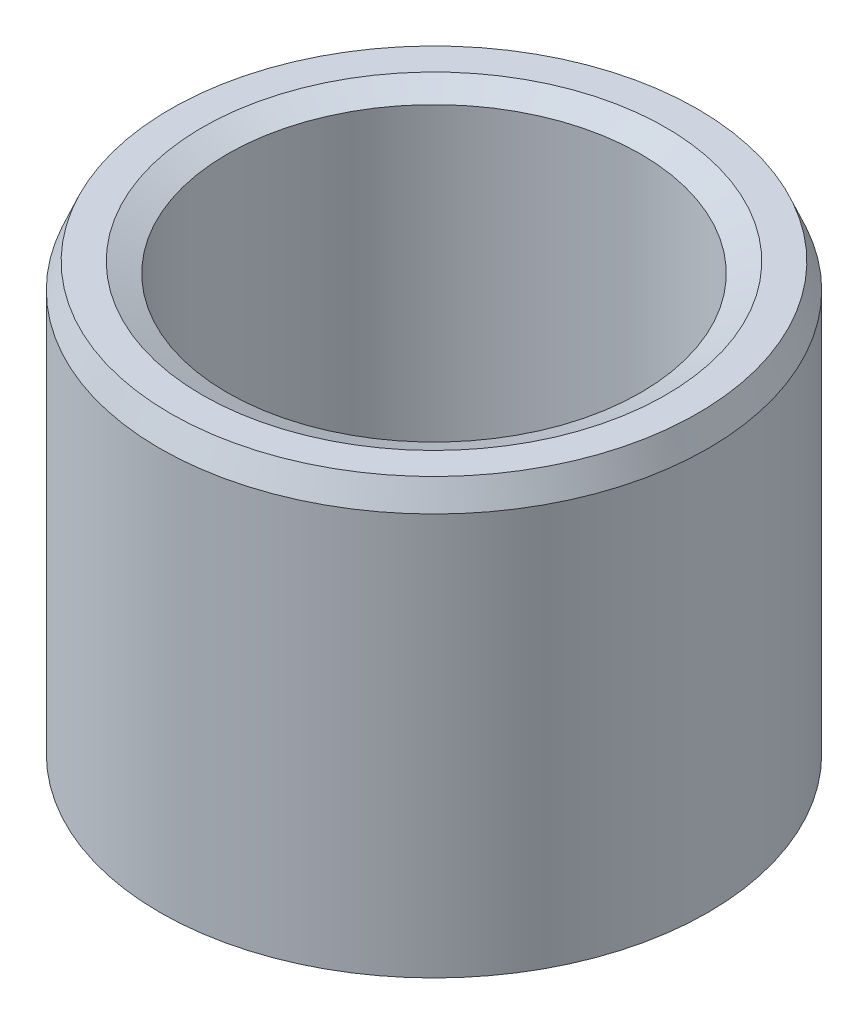
from build123d import *
from OCP.BRepFilletAPI import BRepFilletAPI_MakeChamfer

# Parameters (mm, degrees)
SKETCH1_R           = 15
BOSS_EXTRUDE1_DEPTH = 23.930354002
SKETCH2_R           = 11.30816081
CUT_EXTRUDE1_DEPTH  = 32.979084456
CHAMFER1_SIZE       = 1.372455121
CHAMFER1_SIZE2      = 0.574381194


with BuildPart() as part:
    # Sketch1 → Boss-Extrude1 (new body)
    with BuildSketch(Plane(origin=(0, 0, 0), x_dir=(1, 0, 0), z_dir=(0, 1, 0))):
        Circle(SKETCH1_R)
    extrude(amount=BOSS_EXTRUDE1_DEPTH)

    # Sketch2 → Cut-Extrude1 (cut, through all)
    with BuildSketch(Plane(origin=(0, 0, 0), x_dir=(1, 0, 0), z_dir=(0, 1, 0))):
        Circle(SKETCH2_R)
    extrude(amount=CUT_EXTRUDE1_DEPTH, mode=Mode.SUBTRACT)

    # Chamfer1: one chamfer whose edges measure the first distance from different faces: ONE call of the kernel's chamfer builder (chamfer() names one face for all edges)
    chamfer1_edges_1 = [part.edges().sort_by_distance(p)[0] for p in [
        (-11.30816081, 23.930354002, 0),
    ]]
    chamfer1_side_1 = [part.faces().sort_by_distance(p)[0] for p in [
        (-14.575735931, 23.930354002, 0),
    ]]
    chamfer1_edges_2 = [part.edges().sort_by_distance(p)[0] for p in [
        (-11.30816081, 0, 0),
    ]]
    chamfer1_side_2 = [part.faces().sort_by_distance(p)[0] for p in [
        (-11.30816081, 11.965177001, 0),
    ]]
    chamfer1_edges_3 = [part.edges().sort_by_distance(p)[0] for p in [
        (-15, 0, 0),
    ]]
    chamfer1_side_3 = [part.faces().sort_by_distance(p)[0] for p in [
        (-14.575735931, 0, 0),
    ]]
    chamfer1_edges_4 = [part.edges().sort_by_distance(p)[0] for p in [
        (-15, 23.930354002, 0),
    ]]
    chamfer1_side_4 = [part.faces().sort_by_distance(p)[0] for p in [
        (-15, 11.965177001, 0),
    ]]
    chamfer1 = BRepFilletAPI_MakeChamfer(part.part.solid().wrapped)
    for e in chamfer1_edges_1:
        chamfer1.Add(CHAMFER1_SIZE, CHAMFER1_SIZE2, e.wrapped, chamfer1_side_1[0].wrapped)  # the first distance lies on this face
    for e in chamfer1_edges_2:
        chamfer1.Add(CHAMFER1_SIZE, CHAMFER1_SIZE2, e.wrapped, chamfer1_side_2[0].wrapped)  # the first distance lies on this face
    for e in chamfer1_edges_3:
        chamfer1.Add(CHAMFER1_SIZE, CHAMFER1_SIZE2, e.wrapped, chamfer1_side_3[0].wrapped)  # the first distance lies on this face
    for e in chamfer1_edges_4:
        chamfer1.Add(CHAMFER1_SIZE, CHAMFER1_SIZE2, e.wrapped, chamfer1_side_4[0].wrapped)  # the first distance lies on this face
    add(Compound.cast(chamfer1.Shape()), mode=Mode.REPLACE)


solid = part.part
